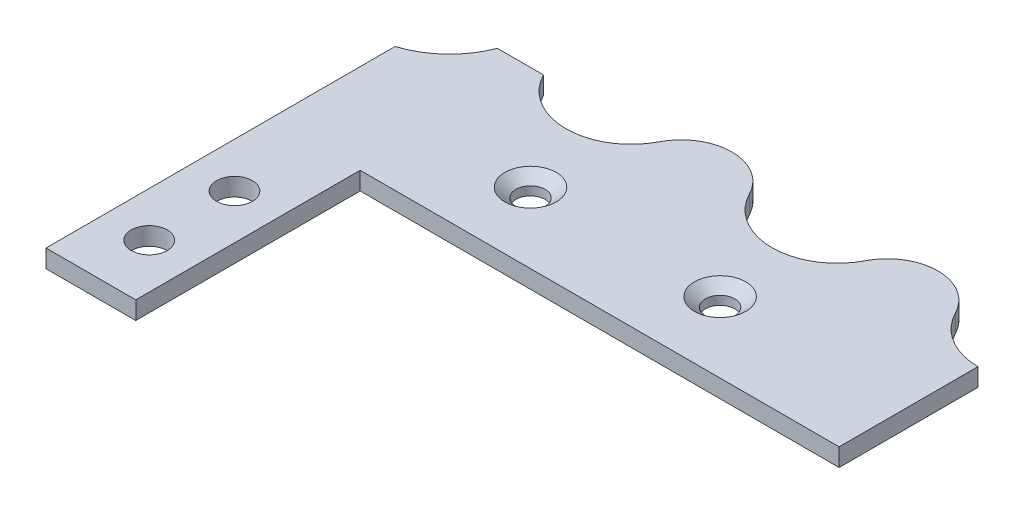
from build123d import *

# Parameters (mm, degrees)
BASE_FLANGE1_DEPTH                                = 2
SKETCH7_R                                         = 2
CUT_EXTRUDE1_DEPTH                                = 2
CSK_FOR_4_FLAT_HEAD_MACHINE_SCREW_100_D           = 3.2639
CSK_FOR_4_FLAT_HEAD_MACHINE_SCREW_100_DEPTH       = 2
CSK_FOR_4_FLAT_HEAD_MACHINE_SCREW_100_CSINK_D     = 5.715
CSK_FOR_4_FLAT_HEAD_MACHINE_SCREW_100_CSINK_ANGLE = 100
CSK_FOR_4_FLAT_HEAD_MACHINE_SCREW_100_TIP         = 0.980574487


# Sheet-metal steps are written as plain solids
with BuildPart() as part:
    # Sketch2 → Base-Flange1 (new body)
    with BuildSketch(Plane(origin=(0, 0, 0), x_dir=(1, 0, 0), z_dir=(0, 1, 0))):
        with BuildLine():
            Line((-29.4, -3.310589071), (-34.53, -3.310589071))
            ThreePointArc((-34.53, -3.310589071), (-36.836910234, -6.744553073), (-40.41, -8.829492668))
            Line((-40.41, -8.829492668), (-40.41, -22.72))
            Line((-40.41, -22.72), (-40.41, -47.72))
            Line((-40.41, -47.72), (-30.41, -47.72))
            Line((-30.41, -47.72), (-30.41, -22.72))
            Line((-30.41, -22.72), (22.95, -22.72))
            Line((22.95, -22.72), (22.95, -7.25))
            ThreePointArc((22.95, -7.25), (19.171063031, -6.187255885), (16.5, -3.310589071))
            ThreePointArc((16.5, -3.310589071), (11.475, -0.241513115), (6.45, -3.310589071))
            ThreePointArc((6.45, -3.310589071), (0, -7.25), (-6.45, -3.310589071))
            ThreePointArc((-6.45, -3.310589071), (-11.475, -0.241513115), (-16.5, -3.310589071))
            ThreePointArc((-16.5, -3.310589071), (-22.95, -7.25), (-29.4, -3.310589071))
        make_face()
    extrude(amount=-BASE_FLANGE1_DEPTH)

    # Sketch7 → Cut-Extrude1 (cut)
    with BuildSketch(Plane(origin=(0, 0, 0), x_dir=(1, 0, 0), z_dir=(0, 1, 0))):
        with Locations(Location((-35.41, -41.22, 0), (0, 0, 270))):
            Circle(SKETCH7_R)
        with Locations(Location((-35.41, -31.72, 0), (0, 0, 270))):
            Circle(SKETCH7_R)
    extrude(amount=-CUT_EXTRUDE1_DEPTH, mode=Mode.SUBTRACT)

    # CSK for #4 Flat Head Machine Screw (100)1
    with Locations(Plane(origin=(0, 0, 0), x_dir=(1, 0, 0), z_dir=(0, 1, 0))):
        with Locations((-19.29, -14.86), (1.83, -14.86)):
            CounterSinkHole(CSK_FOR_4_FLAT_HEAD_MACHINE_SCREW_100_D / 2, CSK_FOR_4_FLAT_HEAD_MACHINE_SCREW_100_CSINK_D / 2, depth=CSK_FOR_4_FLAT_HEAD_MACHINE_SCREW_100_DEPTH, counter_sink_angle=CSK_FOR_4_FLAT_HEAD_MACHINE_SCREW_100_CSINK_ANGLE)
            with Locations((0, 0, -(CSK_FOR_4_FLAT_HEAD_MACHINE_SCREW_100_DEPTH + CSK_FOR_4_FLAT_HEAD_MACHINE_SCREW_100_TIP / 2))):  # 118° drill point
                Cone(0, CSK_FOR_4_FLAT_HEAD_MACHINE_SCREW_100_D / 2, CSK_FOR_4_FLAT_HEAD_MACHINE_SCREW_100_TIP, mode=Mode.SUBTRACT)


solid = part.part
